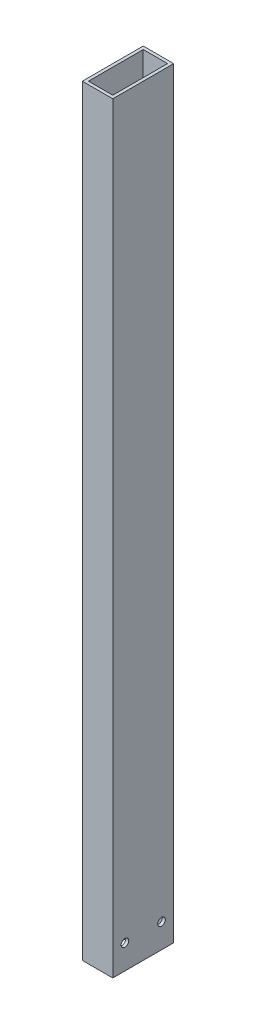
from build123d import *

# Parameters (mm, degrees)
SKETCH3_W                   = 20
SKETCH3_H                   = 40
SKETCH3_W_2                 = 16
SKETCH3_H_2                 = 36
BASE_FLANGE1_DEPTH          = 500
TAP_DRILL_FOR_M6X1_0_TAP1_D = 5


# Sheet-metal steps are written as plain solids
with BuildPart() as part:
    # Sketch3 → Base-Flange1 (new body)
    with BuildSketch(Plane(origin=(0, 0, 0), x_dir=(1, 0, 0), z_dir=(0, 1, 0))):
        Rectangle(SKETCH3_W, SKETCH3_H)
        Rectangle(SKETCH3_W_2, SKETCH3_H_2, mode=Mode.SUBTRACT)
    extrude(amount=-BASE_FLANGE1_DEPTH)

    # Tap Drill for M6x1.0 Tap1 (through all)
    with Locations(Plane(origin=(10, 0, 0), x_dir=(0, 0, -1), z_dir=(1, 0, 0))):
        with Locations((-12, -484), (12, -484)):
            Hole(TAP_DRILL_FOR_M6X1_0_TAP1_D / 2)


solid = part.part
